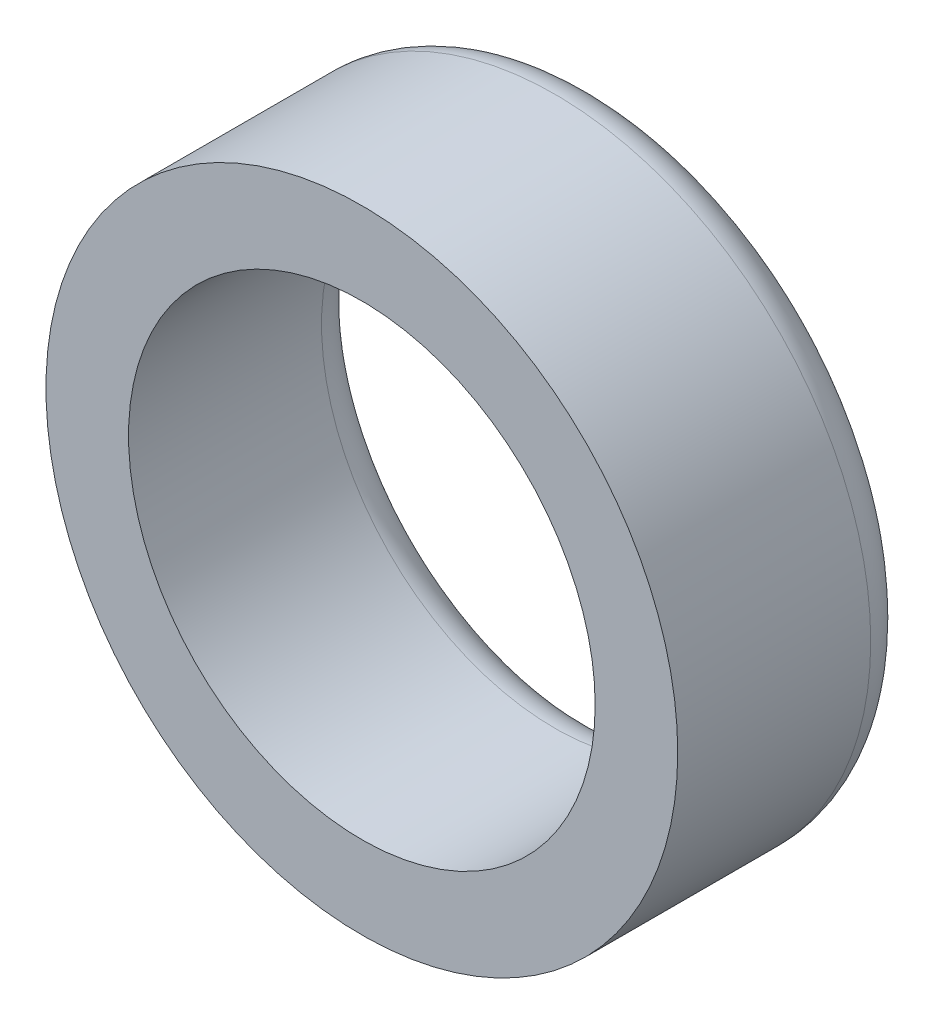
from build123d import *

# Parameters (mm, degrees)
CROQUIS2_R              = 8.225
CROQUIS2_R_2            = 6.075
SALIENTE_EXTRUIR1_DEPTH = 6.1
REDONDEO1_R             = 1.075


with BuildPart() as part:
    # Croquis2 → Saliente-Extruir1 (new body)
    with BuildSketch(Plane.XY):
        Circle(CROQUIS2_R)
        Circle(CROQUIS2_R_2, mode=Mode.SUBTRACT)
    extrude(amount=-SALIENTE_EXTRUIR1_DEPTH)

    # Redondeo1
    redondeo1_edges = [part.edges().sort_by_distance(p)[0] for p in [
        (-8.225, 0, -6.1),
        (-6.075, 0, -6.1),
    ]]
    fillet(redondeo1_edges, radius=REDONDEO1_R - 0.0001)  # a hair under: the kernel refuses the full size


solid = part.part
